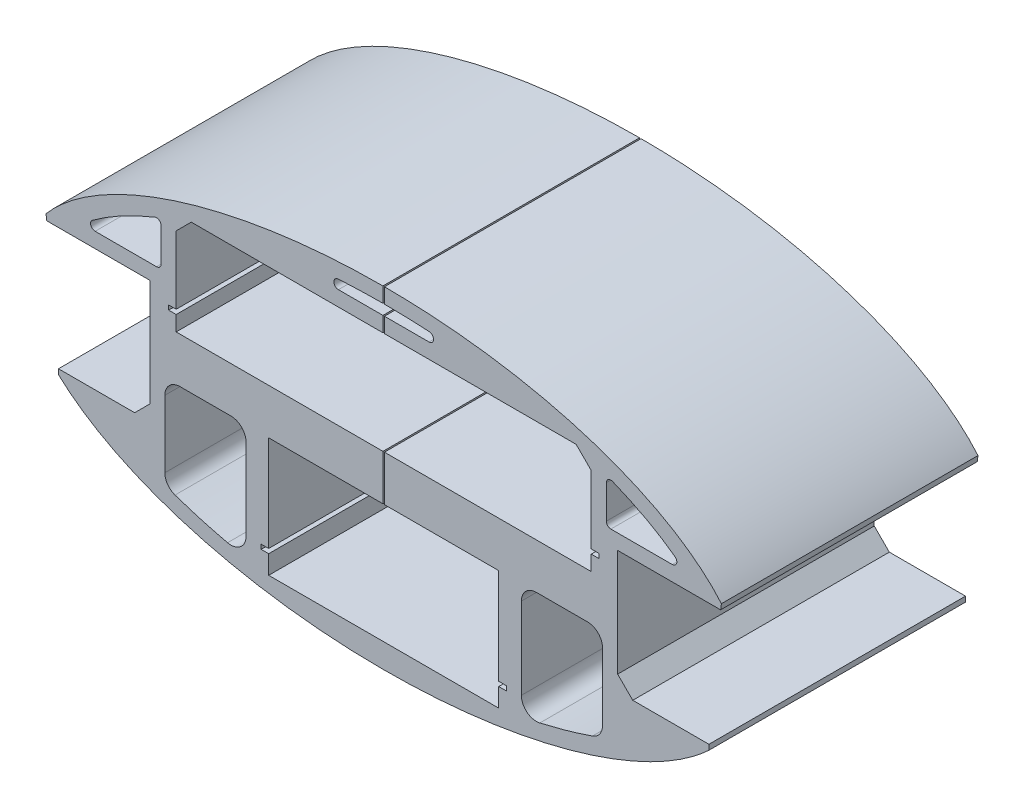
from build123d import *

# Parameters (mm, degrees)
SKETCH1_RX              = 240
SKETCH1_RY              = 110
BOSS_EXTRUDE1_DEPTH     = 170
SKETCH9_W               = 85
SKETCH9_H               = 81
CUT_EXTRUDE4_DEPTH      = 315.006369362
CUT_EXTRUDE5_DEPTH      = 305.024031405
CUT_EXTRUDE6_DEPTH      = 305.024031405
CUT_EXTRUDE6_DEPTH_BACK = 305.024031405
SKETCH11_R              = 8.05220018
SKETCH11_R_2            = 2.75
CHAMFER1_START          = -171
CHAMFER1_DEPTH          = 172
CUT_EXTRUDE7_DEPTH      = 302.762319701
CHAMFER2_SIZE           = 10
CUT_EXTRUDE8_DEPTH      = 302.762319701
CUT_EXTRUDE8_DEPTH_BACK = 302.762319701
SKETCH14_W              = 1
SKETCH14_H              = 125
CUT_EXTRUDE9_DEPTH      = 302.762319832
CUT_EXTRUDE9_DEPTH_BACK = 302.762319832
FILLET1_R               = 10
FILLET2_R               = 3
CHAMFER4_SIZE           = 10


with BuildPart() as part:
    # Sketch1 → Boss-Extrude1 (new body)
    with BuildSketch(Plane.XY):
        with Locations((0, 0)):
            Ellipse(SKETCH1_RX, SKETCH1_RY)
    extrude(amount=-BOSS_EXTRUDE1_DEPTH)

    # Sketch9 → Cut-Extrude4 (cut, through all)
    with BuildSketch(Plane.XY):
        with Locations((197.5, -4.5)):
            Rectangle(SKETCH9_W, SKETCH9_H)
        with Locations((-197.5, -4.5)):
            Rectangle(SKETCH9_W, SKETCH9_H)
    extrude(amount=-CUT_EXTRUDE4_DEPTH, mode=Mode.SUBTRACT)

    # Sketch10 → Cut-Extrude5 (cut, through all)
    with BuildSketch(Plane.XY):
        Polygon((-137.5, 83.1), (137.5, 83.1), (137.5, 28.1), (142.5, 28.1), (142.5, 25.1), (137.5, 25.1), (137.5, 15.1), (-137.5, 15.1), (-137.5, 25.1), (-142.5, 25.1), (-142.5, 28.1), (-137.5, 28.1), align=None)
    extrude(amount=-CUT_EXTRUDE5_DEPTH, mode=Mode.SUBTRACT)

    # Sketch11 → Cut-Extrude6 (cut, two sides: drawn at the far end of the back side and taken through both)
    with BuildSketch(Plane(origin=(0, 0, 0), x_dir=(0, 0, -1), z_dir=(1, 0, 0)).offset(-CUT_EXTRUDE6_DEPTH_BACK)):
        with Locations(Location((60, -2, 0), (0, 0, 270))):
            Circle(SKETCH11_R)
        with Locations(Location((150, -2, 0), (0, 0, 270))):
            Circle(SKETCH11_R_2)
    extrude(amount=CUT_EXTRUDE6_DEPTH + CUT_EXTRUDE6_DEPTH_BACK, mode=Mode.SUBTRACT)

    # Chamfer1: read off the stored shape, not the designer's step
    # Chamfer1 outline → Chamfer1 (cut)
    with BuildSketch(Plane.XY.offset(CHAMFER1_START)):
        with BuildLine():
            add(Edge.make_bspline(
                [(226.783181851, 36), (225.338784139, 37.911428345), (223.742033582, 39.797224556)],
                knots=[0.33341591, 0.33341591, 0.33341591, 0.380954959, 0.380954959, 0.380954959], degree=2, weights=[1, 0.98707721, 0.974650902]))
            Line((223.742033582, 39.797224556), (223.213573476, 36))
            Line((223.213573476, 36), (226.783181851, 36))
        make_face()
        with BuildLine():
            Line((-223.213573476, 36), (-223.742033582, 39.797224556))
            add(Edge.make_bspline(
                [(-223.742033582, 39.797224556), (-225.338784139, 37.911428345), (-226.783181851, 36)],
                knots=[2.760637694, 2.760637694, 2.760637694, 2.808176743, 2.808176743, 2.808176743], degree=2, weights=[0.974650902, 0.98707721, 1]))
            Line((-226.783181851, 36), (-223.213573476, 36))
        make_face()
        with BuildLine():
            add(Edge.make_bspline(
                [(-218.998471635, -45), (-217.313455553, -46.722643886), (-215.500461662, -48.417772396)],
                knots=[3.563050222, 3.563050222, 3.563050222, 3.605808591, 3.605808591, 3.605808591], degree=2, weights=[1, 0.989008328, 0.978425575]))
            Line((-215.500461662, -48.417772396), (-215.462722195, -45))
            Line((-215.462722195, -45), (-218.998471635, -45))
        make_face()
        with BuildLine():
            Line((215.462722195, -45), (215.500461662, -48.417772396))
            add(Edge.make_bspline(
                [(215.500461662, -48.417772396), (217.313455553, -46.722643886), (218.998471635, -45)],
                knots=[5.818969369, 5.818969369, 5.818969369, 5.861727739, 5.861727739, 5.861727739], degree=2, weights=[0.978425575, 0.989008328, 1]))
            Line((218.998471635, -45), (215.462722195, -45))
        make_face()
    extrude(amount=CHAMFER1_DEPTH, mode=Mode.SUBTRACT)

    # Sketch13 → Cut-Extrude7 (cut, through all)
    with BuildSketch(Plane.XY):
        Polygon((-76.2, -81.5), (-76.2, -93.9), (76.2, -93.9), (76.2, -81.5), (81.2, -81.5), (81.2, -78.5), (76.2, -78.5), (76.2, -15), (-76.2, -15), (-76.2, -78.5), (-81.2, -78.5), (-81.2, -81.5), align=None)
    extrude(amount=-CUT_EXTRUDE7_DEPTH, mode=Mode.SUBTRACT)

    # Chamfer2
    chamfer2_edges = [part.edges().sort_by_distance(p)[0] for p in [
        (155, -45, -85),
        (-155, -45, -85),
    ]]
    chamfer(chamfer2_edges, length=CHAMFER2_SIZE)

    # Sketch14 → Cut-Extrude8 (cut, two sides: drawn at the far end of the back side and taken through both)
    with BuildSketch(Plane.XY.offset(-CUT_EXTRUDE8_DEPTH_BACK)):
        with Locations((0, 47.5)):
            Rectangle(SKETCH14_W, SKETCH14_H)
    extrude(amount=CUT_EXTRUDE8_DEPTH + CUT_EXTRUDE8_DEPTH_BACK, mode=Mode.SUBTRACT)

    # Sketch15 → Cut-Extrude9 (cut, two sides: drawn at the far end of the back side and taken through both)
    with BuildSketch(Plane.XY.offset(-CUT_EXTRUDE9_DEPTH_BACK)):
        with BuildLine():
            Line((147.5, 75.514694834), (147.5, 46))
            Line((147.5, 46), (199.781755924, 46))
            add(Edge.make_bspline(
                [(199.781755924, 46), (179.990233789, 62.979001801), (147.5, 75.514694834)],
                knots=[3.619587852, 3.619587852, 3.619587852, 3.997470903, 3.997470903, 3.997470903], degree=2, weights=[1, 0.982203587, 1]))
        make_face()
        with BuildLine():
            Line((91.2, -91.41689608), (91.2, -15))
            Line((91.2, -15), (145, -15))
            Line((145, -15), (145, -76.465113485))
            add(Edge.make_bspline(
                [(91.2, -91.41689608), (120.495747781, -85.643811522), (145, -76.465113485)],
                knots=[1.988139758, 1.988139758, 1.988139758, 2.27109284, 2.27109284, 2.27109284], degree=2, weights=[1, 0.990008876, 1]))
        make_face()
        with BuildLine():
            Line((-82.129314955, 93.1), (82.129314955, 93.1))
            add(Edge.make_bspline(
                [(82.129314955, 93.1), (0, 107.411385607), (-82.129314955, 93.1)],
                knots=[4.338735578, 4.338735578, 4.338735578, 5.086042382, 5.086042382, 5.086042382], degree=2, weights=[1, 0.931, 1]))
        make_face()
        with BuildLine():
            Line((-91.2, -91.41689608), (-91.2, -15))
            Line((-91.2, -15), (-145, -15))
            Line((-145, -15), (-145, -76.465113485))
            add(Edge.make_bspline(
                [(-145, -76.465113485), (-120.495747781, -85.643811522), (-91.2, -91.41689608)],
                knots=[0.870499814, 0.870499814, 0.870499814, 1.153452896, 1.153452896, 1.153452896], degree=2, weights=[1, 0.990008876, 1]))
        make_face()
        with BuildLine():
            Line((-147.5, 75.514694834), (-147.5, 46))
            Line((-147.5, 46), (-199.781755924, 46))
            add(Edge.make_bspline(
                [(-147.5, 75.514694834), (-179.990233789, 62.979001801), (-199.781755924, 46)],
                knots=[5.427307058, 5.427307058, 5.427307058, 5.805190109, 5.805190109, 5.805190109], degree=2, weights=[1, 0.982203587, 1]))
        make_face()
    extrude(amount=CUT_EXTRUDE9_DEPTH + CUT_EXTRUDE9_DEPTH_BACK, mode=Mode.SUBTRACT)

    # Fillet1
    fillet1_edges = [part.edges().sort_by_distance(p)[0] for p in [
        (-145, -15, -85),
        (-145, -76.465113485, -85),
        (-91.2, -91.41689608, -85),
        (145, -76.465113485, -85),
        (91.2, -91.41689608, -85),
        (91.2, -15, -85),
        (-91.2, -15, -85),
        (145, -15, -85),
    ]]
    fillet(fillet1_edges, radius=FILLET1_R)

    # Fillet2
    fillet2_edges = [part.edges().sort_by_distance(p)[0] for p in [
        (-82.129314955, 93.1, -85),
        (82.129314955, 93.1, -85),
        (199.781755924, 46, -85),
        (147.5, 75.514694834, -85),
        (147.5, 46, -85),
        (-147.5, 75.514694834, -85),
        (-147.5, 46, -85),
        (-199.781755924, 46, -85),
    ]]
    fillet(fillet2_edges, radius=FILLET2_R)

    # Chamfer4
    chamfer4_edges = [part.edges().sort_by_distance(p)[0] for p in [
        (-137.5, 83.1, -85),
        (137.5, 83.1, -85),
    ]]
    chamfer(chamfer4_edges, length=CHAMFER4_SIZE)


solid = part.part
